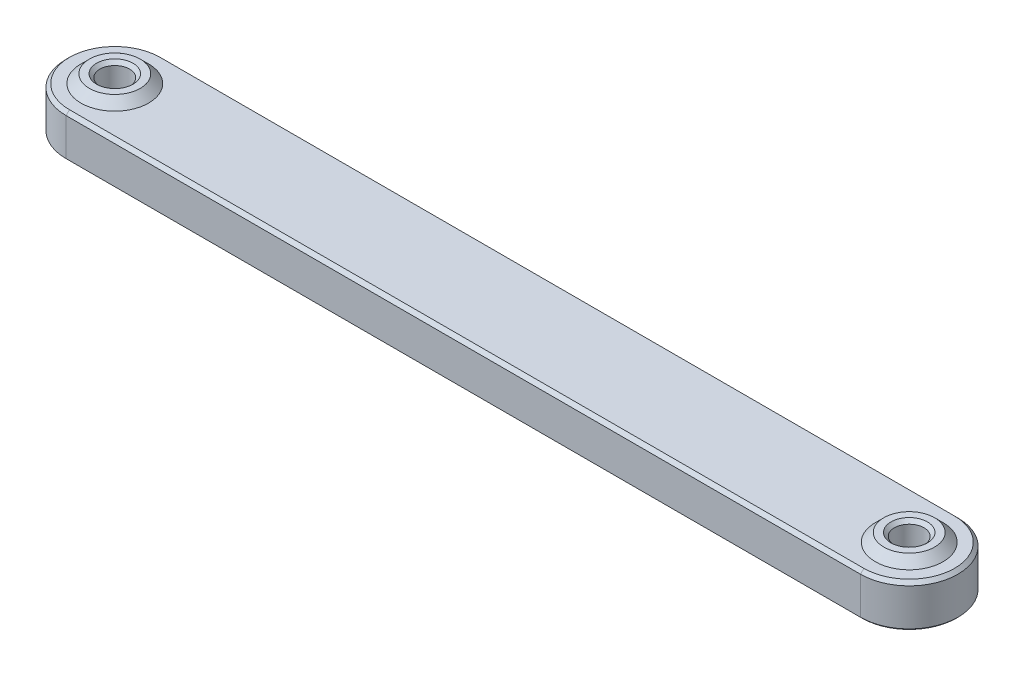
from build123d import *

# Parameters (mm, degrees)
CROQUIS2_R              = 1.75
SALIENTE_EXTRUIR1_DEPTH = 5
CROQUIS3_R              = 3
CROQUIS3_R_2            = 1.75
SALIENTE_EXTRUIR2_DEPTH = 1
CHAFL_N1_SIZE           = 1
CHAFL_N2_SIZE           = 0.4
CROQUIS4_R              = 0.4
CROQUIS4_R_2            = 1.75
CORTAR_EXTRUIR1_DEPTH   = 2.3
CHAFL_N3_SIZE           = 0.2
CORTAR_EXTRUIR2_DEPTH   = 0.2
CORTAR_EXTRUIR3_DEPTH   = 0.2
CHAFL_N4_SIZE           = 0.4


# Some blends are built 0.0001 mm under size
with BuildPart() as part:
    # Croquis2 → Saliente-Extruir1 (new body)
    with BuildSketch(Plane(origin=(0, 0, 0), x_dir=(1, 0, 0), z_dir=(0, 1, 0))):
        with BuildLine():
            Line((0, 5.75), (93.75, 5.75))
            ThreePointArc((93.75, 5.75), (99.5, 0), (93.75, -5.75))
            Line((93.75, -5.75), (0, -5.75))
            ThreePointArc((0, -5.75), (-5.75, 0), (0, 5.75))
        make_face()
        with Locations(Location((93.75, 0, 0), (0, 0, 270))):
            Circle(CROQUIS2_R, mode=Mode.SUBTRACT)
        with Locations(Location((0, 0, 0), (0, 0, 270))):
            Circle(CROQUIS2_R, mode=Mode.SUBTRACT)
    extrude(amount=SALIENTE_EXTRUIR1_DEPTH)

    # Croquis3 → Saliente-Extruir2 (add)
    # profile 1 of 2: a face of its own
    with BuildSketch(Plane(origin=(0, 5, 0), x_dir=(1, 0, 0), z_dir=(0, 1, 0))):
        with Locations(Location((93.75, 0, 0), (0, 0, 270))):
            Circle(CROQUIS3_R)
        with Locations(Location((93.75, 0, 0), (0, 0, 270))):
            Circle(CROQUIS3_R_2, mode=Mode.SUBTRACT)
    # profile 2 of 2: a face of its own
    with BuildSketch(Plane(origin=(0, 5, 0), x_dir=(1, 0, 0), z_dir=(0, 1, 0))):
        with Locations(Location((0, 0, 0), (0, 0, 270))):
            Circle(CROQUIS3_R)
        with Locations(Location((0, 0, 0), (0, 0, 270))):
            Circle(CROQUIS3_R_2, mode=Mode.SUBTRACT)
    extrude(amount=SALIENTE_EXTRUIR2_DEPTH)

    # Chaflán1
    chafl_n1_edges = [part.edges().sort_by_distance(p)[0] for p in [
        (93.75, 5, -3),
        (0, 5, -3),
    ]]
    chamfer(chafl_n1_edges, length=CHAFL_N1_SIZE - 0.0001)  # a hair under: the kernel refuses the full size

    # Chaflán2
    chafl_n2_edges = [part.edges().sort_by_distance(p)[0] for p in [
        (46.875, 5, 5.75),
        (99.5, 5, 0),
        (93.75, 6, -1.75),
        (46.875, 5, -5.75),
        (0, 6, -1.75),
        (-5.75, 5, 0),
    ]]
    chamfer(chafl_n2_edges, length=CHAFL_N2_SIZE)

    # Croquis4 → Cortar-Extruir1 (cut)
    # profile 1 of 31: a face of its own
    with BuildSketch(Plane.XZ):
        with Locations((90.975, 1.602146997)):
            Circle(CROQUIS4_R)
    # profile 2 of 31: a face of its own
    with BuildSketch(Plane.XZ):
        with Locations((90.975, -1.602146997)):
            Circle(CROQUIS4_R)
    # profile 3 of 31: a face of its own
    with BuildSketch(Plane.XZ):
        with Locations((93.75, -3.204293994)):
            Circle(CROQUIS4_R)
    # profile 4 of 31: a face of its own
    with BuildSketch(Plane.XZ):
        with Locations((96.525, -1.602146997)):
            Circle(CROQUIS4_R)
    # profile 5 of 31: a face of its own
    with BuildSketch(Plane.XZ):
        with Locations((96.525, 1.602146997)):
            Circle(CROQUIS4_R)
    # profile 6 of 31: a face of its own
    with BuildSketch(Plane.XZ):
        with Locations((93.75, 3.204293994)):
            Circle(CROQUIS4_R)
    # profile 7 of 31: a face of its own
    with BuildSketch(Plane.XZ):
        Polygon((90.975, 1.602146997), (90.975, -1.602146997), (93.75, -3.204293994), (96.525, -1.602146997), (96.525, 1.602146997), (93.75, 3.204293994), align=None)
        with Locations(Location((93.75, 0, 0), (0, 0, 270))):
            Circle(CROQUIS4_R_2, mode=Mode.SUBTRACT)
    # profile 8 of 31: a face of its own
    with BuildSketch(Plane.XZ):
        with BuildLine():
            Line((94.096410162, 3.004293994), (93.75, 3.204293994))
            Line((93.75, 3.204293994), (93.403589838, 3.004293994))
            ThreePointArc((93.403589838, 3.004293994), (93.75, 2.804293994), (94.096410162, 3.004293994))
        make_face()
    # profile 9 of 31: a face of its own
    with BuildSketch(Plane.XZ):
        with BuildLine():
            Line((93.403589838, 3.004293994), (93.75, 3.204293994))
            Line((93.75, 3.204293994), (94.096410162, 3.004293994))
            ThreePointArc((94.096410162, 3.004293994), (94.136370331, 3.100766376), (94.15, 3.204293994))
            ThreePointArc((94.15, 3.204293994), (93.646472382, 3.590664325), (93.403589838, 3.004293994))
        make_face()
    # profile 10 of 31: a face of its own
    with BuildSketch(Plane.XZ):
        with BuildLine():
            Line((94.096410162, 3.004293994), (93.75, 3.204293994))
            Line((93.75, 3.204293994), (93.403589838, 3.004293994))
            ThreePointArc((93.403589838, 3.004293994), (93.75, 2.804293994), (94.096410162, 3.004293994))
        make_face()
    # profile 11 of 31: a face of its own
    with BuildSketch(Plane.XZ):
        with BuildLine():
            Line((93.403589838, 3.004293994), (93.75, 3.204293994))
            Line((93.75, 3.204293994), (94.096410162, 3.004293994))
            ThreePointArc((94.096410162, 3.004293994), (94.136370331, 3.100766376), (94.15, 3.204293994))
            ThreePointArc((94.15, 3.204293994), (93.646472382, 3.590664325), (93.403589838, 3.004293994))
        make_face()
    # profile 12 of 31: a face of its own
    with BuildSketch(Plane.XZ):
        with BuildLine():
            ThreePointArc((96.925, 1.602146997), (96.628527618, 1.988517328), (96.178589838, 1.802146997))
            Line((96.178589838, 1.802146997), (96.525, 1.602146997))
            Line((96.525, 1.602146997), (96.525, 1.202146997))
            ThreePointArc((96.525, 1.202146997), (96.807842712, 1.319304285), (96.925, 1.602146997))
        make_face()
    # profile 13 of 31: a face of its own
    with BuildSketch(Plane.XZ):
        with BuildLine():
            Line((96.525, 1.602146997), (96.178589838, 1.802146997))
            ThreePointArc((96.178589838, 1.802146997), (96.178589838, 1.402146997), (96.525, 1.202146997))
            Line((96.525, 1.202146997), (96.525, 1.602146997))
        make_face()
    # profile 14 of 31: a face of its own
    with BuildSketch(Plane.XZ):
        with BuildLine():
            ThreePointArc((96.925, 1.602146997), (96.628527618, 1.988517328), (96.178589838, 1.802146997))
            Line((96.178589838, 1.802146997), (96.525, 1.602146997))
            Line((96.525, 1.602146997), (96.525, 1.202146997))
            ThreePointArc((96.525, 1.202146997), (96.807842712, 1.319304285), (96.925, 1.602146997))
        make_face()
    # profile 15 of 31: a face of its own
    with BuildSketch(Plane.XZ):
        with BuildLine():
            Line((96.525, 1.602146997), (96.178589838, 1.802146997))
            ThreePointArc((96.178589838, 1.802146997), (96.178589838, 1.402146997), (96.525, 1.202146997))
            Line((96.525, 1.202146997), (96.525, 1.602146997))
        make_face()
    # profile 16 of 31: a face of its own
    with BuildSketch(Plane.XZ):
        with BuildLine():
            ThreePointArc((96.925, -1.602146997), (96.807842712, -1.319304285), (96.525, -1.202146997))
            Line((96.525, -1.202146997), (96.525, -1.602146997))
            Line((96.525, -1.602146997), (96.178589838, -1.802146997))
            ThreePointArc((96.178589838, -1.802146997), (96.628527618, -1.988517328), (96.925, -1.602146997))
        make_face()
    # profile 17 of 31: a face of its own
    with BuildSketch(Plane.XZ):
        with BuildLine():
            Line((96.525, -1.602146997), (96.525, -1.202146997))
            ThreePointArc((96.525, -1.202146997), (96.178589838, -1.402146997), (96.178589838, -1.802146997))
            Line((96.178589838, -1.802146997), (96.525, -1.602146997))
        make_face()
    # profile 18 of 31: a face of its own
    with BuildSketch(Plane.XZ):
        with BuildLine():
            ThreePointArc((96.925, -1.602146997), (96.807842712, -1.319304285), (96.525, -1.202146997))
            Line((96.525, -1.202146997), (96.525, -1.602146997))
            Line((96.525, -1.602146997), (96.178589838, -1.802146997))
            ThreePointArc((96.178589838, -1.802146997), (96.628527618, -1.988517328), (96.925, -1.602146997))
        make_face()
    # profile 19 of 31: a face of its own
    with BuildSketch(Plane.XZ):
        with BuildLine():
            Line((96.525, -1.602146997), (96.525, -1.202146997))
            ThreePointArc((96.525, -1.202146997), (96.178589838, -1.402146997), (96.178589838, -1.802146997))
            Line((96.178589838, -1.802146997), (96.525, -1.602146997))
        make_face()
    # profile 20 of 31: a face of its own
    with BuildSketch(Plane.XZ):
        with BuildLine():
            ThreePointArc((94.096410162, -3.004293994), (93.75, -2.804293994), (93.403589838, -3.004293994))
            Line((93.403589838, -3.004293994), (93.75, -3.204293994))
            Line((93.75, -3.204293994), (94.096410162, -3.004293994))
        make_face()
    # profile 21 of 31: a face of its own
    with BuildSketch(Plane.XZ):
        with BuildLine():
            Line((93.75, -3.204293994), (93.403589838, -3.004293994))
            ThreePointArc((93.403589838, -3.004293994), (93.646472382, -3.590664325), (94.15, -3.204293994))
            ThreePointArc((94.15, -3.204293994), (94.136370331, -3.100766376), (94.096410162, -3.004293994))
            Line((94.096410162, -3.004293994), (93.75, -3.204293994))
        make_face()
    # profile 22 of 31: a face of its own
    with BuildSketch(Plane.XZ):
        with BuildLine():
            ThreePointArc((94.096410162, -3.004293994), (93.75, -2.804293994), (93.403589838, -3.004293994))
            Line((93.403589838, -3.004293994), (93.75, -3.204293994))
            Line((93.75, -3.204293994), (94.096410162, -3.004293994))
        make_face()
    # profile 23 of 31: a face of its own
    with BuildSketch(Plane.XZ):
        with BuildLine():
            Line((93.75, -3.204293994), (93.403589838, -3.004293994))
            ThreePointArc((93.403589838, -3.004293994), (93.646472382, -3.590664325), (94.15, -3.204293994))
            ThreePointArc((94.15, -3.204293994), (94.136370331, -3.100766376), (94.096410162, -3.004293994))
            Line((94.096410162, -3.004293994), (93.75, -3.204293994))
        make_face()
    # profile 24 of 31: a face of its own
    with BuildSketch(Plane.XZ):
        with BuildLine():
            ThreePointArc((91.375, -1.602146997), (91.257842712, -1.319304285), (90.975, -1.202146997))
            Line((90.975, -1.202146997), (90.975, -1.602146997))
            Line((90.975, -1.602146997), (91.321410162, -1.802146997))
            ThreePointArc((91.321410162, -1.802146997), (91.361370331, -1.705674615), (91.375, -1.602146997))
        make_face()
    # profile 25 of 31: a face of its own
    with BuildSketch(Plane.XZ):
        with BuildLine():
            Line((90.975, -1.602146997), (90.975, -1.202146997))
            ThreePointArc((90.975, -1.202146997), (90.628589838, -1.802146997), (91.321410162, -1.802146997))
            Line((91.321410162, -1.802146997), (90.975, -1.602146997))
        make_face()
    # profile 26 of 31: a face of its own
    with BuildSketch(Plane.XZ):
        with BuildLine():
            ThreePointArc((91.375, -1.602146997), (91.257842712, -1.319304285), (90.975, -1.202146997))
            Line((90.975, -1.202146997), (90.975, -1.602146997))
            Line((90.975, -1.602146997), (91.321410162, -1.802146997))
            ThreePointArc((91.321410162, -1.802146997), (91.361370331, -1.705674615), (91.375, -1.602146997))
        make_face()
    # profile 27 of 31: a face of its own
    with BuildSketch(Plane.XZ):
        with BuildLine():
            Line((90.975, -1.602146997), (90.975, -1.202146997))
            ThreePointArc((90.975, -1.202146997), (90.628589838, -1.802146997), (91.321410162, -1.802146997))
            Line((91.321410162, -1.802146997), (90.975, -1.602146997))
        make_face()
    # profile 28 of 31: a face of its own
    with BuildSketch(Plane.XZ):
        with BuildLine():
            ThreePointArc((91.375, 1.602146997), (91.361370331, 1.705674615), (91.321410162, 1.802146997))
            Line((91.321410162, 1.802146997), (90.975, 1.602146997))
            Line((90.975, 1.602146997), (90.975, 1.202146997))
            ThreePointArc((90.975, 1.202146997), (91.257842712, 1.319304285), (91.375, 1.602146997))
        make_face()
    # profile 29 of 31: a face of its own
    with BuildSketch(Plane.XZ):
        with BuildLine():
            Line((90.975, 1.602146997), (91.321410162, 1.802146997))
            ThreePointArc((91.321410162, 1.802146997), (90.628589838, 1.802146997), (90.975, 1.202146997))
            Line((90.975, 1.202146997), (90.975, 1.602146997))
        make_face()
    # profile 30 of 31: a face of its own
    with BuildSketch(Plane.XZ):
        with BuildLine():
            ThreePointArc((91.375, 1.602146997), (91.361370331, 1.705674615), (91.321410162, 1.802146997))
            Line((91.321410162, 1.802146997), (90.975, 1.602146997))
            Line((90.975, 1.602146997), (90.975, 1.202146997))
            ThreePointArc((90.975, 1.202146997), (91.257842712, 1.319304285), (91.375, 1.602146997))
        make_face()
    # profile 31 of 31: a face of its own
    with BuildSketch(Plane.XZ):
        with BuildLine():
            Line((90.975, 1.602146997), (91.321410162, 1.802146997))
            ThreePointArc((91.321410162, 1.802146997), (90.628589838, 1.802146997), (90.975, 1.202146997))
            Line((90.975, 1.202146997), (90.975, 1.602146997))
        make_face()
    extrude(amount=-CORTAR_EXTRUIR1_DEPTH, mode=Mode.SUBTRACT)

    # Chaflán3
    chafl_n3_edges = [part.edges().sort_by_distance(p)[0] for p in [
        (0, 0, -1.75),
        (90.628589838, 0, 1.802146997),
        (90.975, 0, 0),
        (90.628589838, 0, -1.802146997),
        (92.3625, 0, -2.403220496),
        (93.75, 0, -3.604293994),
        (95.1375, 0, -2.403220496),
        (96.871410162, 0, -1.802146997),
        (96.525, 0, 0),
        (96.871410162, 0, 1.802146997),
        (95.1375, 0, 2.403220496),
        (93.75, 0, 3.604293994),
        (92.3625, 0, 2.403220496),
        (-5.75, 0, 0),
        (46.875, 0, -5.75),
        (99.5, 0, 0),
        (46.875, 0, 5.75),
    ]]
    chamfer(chafl_n3_edges, length=CHAFL_N3_SIZE)

    # Croquis5 → Cortar-Extruir2 (cut)
    with BuildSketch(Plane.XZ.offset(-2.3)):
        with BuildLine():
            Line((93.403589838, 3.004293994), (92, 2.193931023))
            Line((92, 2.193931023), (92, 0))
            ThreePointArc((92, 0), (93.75, 1.75), (95.5, 0))
            Line((95.5, 0), (95.5, 2.193931023))
            Line((95.5, 2.193931023), (94.096410162, 3.004293994))
            ThreePointArc((94.096410162, 3.004293994), (93.75, 3.604293994), (93.403589838, 3.004293994))
        make_face()
        with BuildLine():
            ThreePointArc((95.5, 0), (93.75, -1.75), (92, 0))
            Line((92, 0), (92, -2.193931023))
            Line((92, -2.193931023), (93.403589838, -3.004293994))
            ThreePointArc((93.403589838, -3.004293994), (93.75, -3.604293994), (94.096410162, -3.004293994))
            Line((94.096410162, -3.004293994), (95.5, -2.193931023))
            Line((95.5, -2.193931023), (95.5, 0))
        make_face()
    extrude(amount=-CORTAR_EXTRUIR2_DEPTH, mode=Mode.SUBTRACT)

    # Croquis6 → Cortar-Extruir3 (cut)
    with BuildSketch(Plane.XZ.offset(-2.5)):
        with BuildLine():
            Line((93.75, 1.75), (92, 1.75))
            Line((92, 1.75), (92, 0))
            ThreePointArc((92, 0), (92.512563133, 1.237436867), (93.75, 1.75))
        make_face()
        with BuildLine():
            Line((95.5, 1.75), (93.75, 1.75))
            ThreePointArc((93.75, 1.75), (94.987436867, 1.237436867), (95.5, 0))
            Line((95.5, 0), (95.5, 1.75))
        make_face()
        with BuildLine():
            Line((95.5, -1.75), (95.5, 0))
            ThreePointArc((95.5, 0), (94.987436866, -1.237436868), (93.749999997, -1.75))
            Line((93.749999997, -1.75), (95.5, -1.75))
        make_face()
        with BuildLine():
            ThreePointArc((93.749999997, -1.75), (92.512563132, -1.237436866), (92, 0))
            Line((92, 0), (92, -1.75))
            Line((92, -1.75), (93.749999997, -1.75))
        make_face()
    extrude(amount=-CORTAR_EXTRUIR3_DEPTH, mode=Mode.SUBTRACT)

    # Chaflán4
    # the kernel refuses this chamfer: 0.4 mm, written as the material it takes off along each edge
    with BuildSketch(Plane(origin=(93.75, 2.7, 0), x_dir=(1, 0, 0), z_dir=(0, 0, 1))) as chafl_n4_piece_1_section:
        Polygon((1.75, CHAFL_N4_SIZE), (1.75 + CHAFL_N4_SIZE, 0), (1.75, 0), align=None)
    chafl_n4_piece_1 = revolve(axis=Axis((93.75, 2.7, 0), (0, 1, 0)), revolution_arc=90.000000086, mode=Mode.PRIVATE)
    chafl_n4_piece_1 = split(chafl_n4_piece_1, bisect_by=Plane(origin=(95.5, 2.845713539, -1.262575897), z_dir=(-1, 0, 0)), keep=Keep.TOP, mode=Mode.PRIVATE)
    chafl_n4_piece_1 = split(chafl_n4_piece_1, bisect_by=Plane(origin=(95.012575897, 2.845713539, -1.75), z_dir=(0, 0, 1)), keep=Keep.TOP, mode=Mode.PRIVATE)
    add(chafl_n4_piece_1, mode=Mode.SUBTRACT)
    with BuildSketch(Plane(origin=(93.75, 2.7, 0), x_dir=(-1, 0, 0), z_dir=(0, 0, -1))) as chafl_n4_piece_2_section:
        Polygon((1.75, CHAFL_N4_SIZE), (1.75 + CHAFL_N4_SIZE, 0), (1.75, 0), align=None)
    chafl_n4_piece_2 = revolve(axis=Axis((93.75, 2.7, 0), (0, 1, 0)), revolution_arc=90, mode=Mode.PRIVATE)
    chafl_n4_piece_2 = split(chafl_n4_piece_2, bisect_by=Plane(origin=(92, 2.845713539, 1.262575897), z_dir=(1, 0, 0)), keep=Keep.TOP, mode=Mode.PRIVATE)
    chafl_n4_piece_2 = split(chafl_n4_piece_2, bisect_by=Plane(origin=(92.487424103, 2.845713539, 1.75), z_dir=(0, 0, -1)), keep=Keep.TOP, mode=Mode.PRIVATE)
    add(chafl_n4_piece_2, mode=Mode.SUBTRACT)
    with BuildSketch(Plane(origin=(93.75, 2.7, 0), x_dir=(0, 0, 1), z_dir=(-1, 0, 0))) as chafl_n4_piece_3_section:
        Polygon((1.75, CHAFL_N4_SIZE), (1.75 + CHAFL_N4_SIZE, 0), (1.75, 0), align=None)
    chafl_n4_piece_3 = revolve(axis=Axis((93.75, 2.7, 0), (0, 1, 0)), revolution_arc=90, mode=Mode.PRIVATE)
    chafl_n4_piece_3 = split(chafl_n4_piece_3, bisect_by=Plane(origin=(95.5, 2.845713539, 1.262575897), z_dir=(-1, 0, 0)), keep=Keep.TOP, mode=Mode.PRIVATE)
    chafl_n4_piece_3 = split(chafl_n4_piece_3, bisect_by=Plane(origin=(95.012575897, 2.845713539, 1.75), z_dir=(0, 0, -1)), keep=Keep.TOP, mode=Mode.PRIVATE)
    add(chafl_n4_piece_3, mode=Mode.SUBTRACT)
    with BuildSketch(Plane(origin=(93.75, 2.7, 0), x_dir=(-1.5058390090416618e-09, 0, -1.0), z_dir=(1.0, 0, -1.5058390090416618e-09))) as chafl_n4_piece_4_section:
        Polygon((1.75, CHAFL_N4_SIZE), (1.75 + CHAFL_N4_SIZE, 0), (1.75, 0), align=None)
    chafl_n4_piece_4 = revolve(axis=Axis((93.75, 2.7, 0), (0, 1, 0)), revolution_arc=89.999999914, mode=Mode.PRIVATE)
    chafl_n4_piece_4 = split(chafl_n4_piece_4, bisect_by=Plane(origin=(92, 2.845713539, -1.262575897), z_dir=(1, 0, 0)), keep=Keep.TOP, mode=Mode.PRIVATE)
    chafl_n4_piece_4 = split(chafl_n4_piece_4, bisect_by=Plane(origin=(92.487424103, 2.845713539, -1.75), z_dir=(0, 0, 1)), keep=Keep.TOP, mode=Mode.PRIVATE)
    add(chafl_n4_piece_4, mode=Mode.SUBTRACT)


solid = part.part
